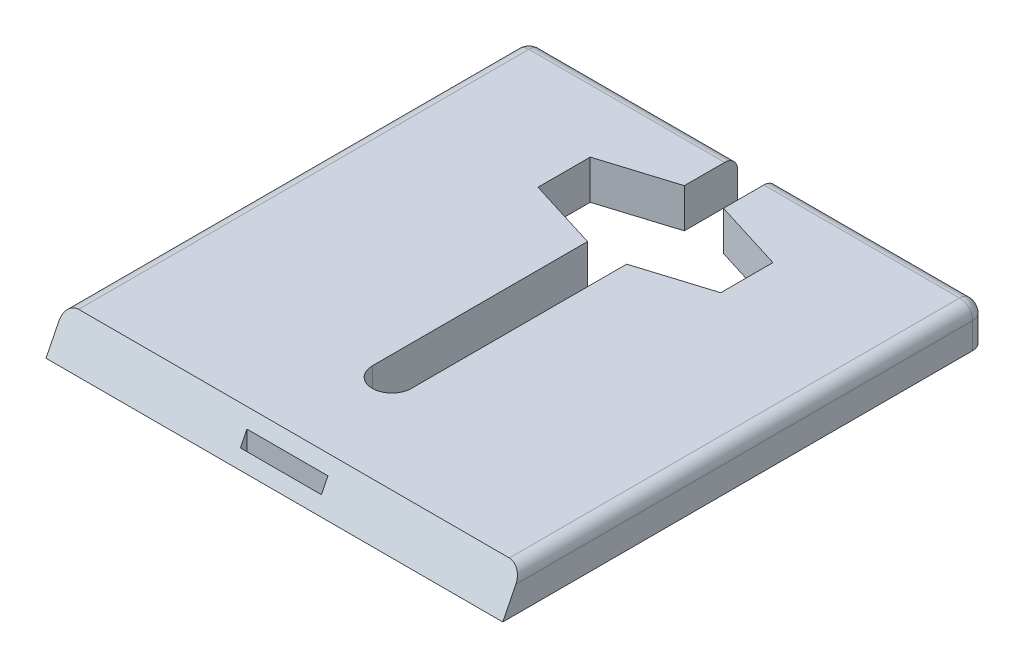
from build123d import *

# Parameters (mm, degrees)
SKIZZE1_W                       = 17.5
SKIZZE1_H                       = 18.5
AUFSATZ_LINEAR_AUSTRAGEN1_DEPTH = 1.5
VERRUNDUNG1_R                   = 0.5
SCHNITT_LINEAR_AUSTRAGEN1_REACH = 21.851
VERRUNDUNG2_R                   = 0.5
SCHL_SSELLOCH_DEPTH             = 1.5
SKIZZE6_W                       = 3.103008178
SKIZZE6_H                       = 0.25
GRIFF_DEPTH                     = 1.5
LANGLOCH_ANTENNE_START          = -1.5
LANGLOCH_ANTENNE_DEPTH          = 1.5
SCHNITT_LINEAR_AUSTRAGEN2_DEPTH = 1.5


with BuildPart() as part:
    # Skizze1 → Aufsatz-Linear austragen1 (new body)
    with BuildSketch(Plane(origin=(0, 0, 0), x_dir=(1, 0, 0), z_dir=(0, 1, 0))):
        Rectangle(SKIZZE1_W, SKIZZE1_H)
    extrude(amount=AUFSATZ_LINEAR_AUSTRAGEN1_DEPTH)

    # Verrundung1
    verrundung1_edges = [part.edges().sort_by_distance(p)[0] for p in [
        (-8.75, 1.5, 0),
        (8.75, 1.5, 0),
        (0, 1.5, -9.25),
    ]]
    fillet(verrundung1_edges, radius=VERRUNDUNG1_R)

    # Schnitt-Linear austragen1: up to this face of the body (flat: up to its plane)
    schnitt_linear_austragen1_end = Plane(part.part.faces().sort_by_distance((8.75, 0.5, 0))[0])
    # Skizze2 → Schnitt-Linear austragen1 (cut, up to the picked face)
    with BuildSketch(Plane.ZY.offset(8.75), mode=Mode.PRIVATE) as schnitt_linear_austragen1_sk1:
        Polygon((9.25, 0), (8.5, 1.5), (9.25, 1.5), align=None)
    schnitt_linear_austragen1_tool1 = split(extrude(schnitt_linear_austragen1_sk1.sketch, amount=-SCHNITT_LINEAR_AUSTRAGEN1_REACH, mode=Mode.PRIVATE), bisect_by=schnitt_linear_austragen1_end, keep=Keep.BOTH, mode=Mode.PRIVATE)
    add(schnitt_linear_austragen1_tool1.solids().sort_by(Axis((-8.75, 1, 9), (1, 0, 0)))[0], mode=Mode.SUBTRACT)

    # Verrundung2
    # the kernel refuses this fillet: 0.5 mm, written as the material it takes off along each edge
    with BuildSketch(Plane(origin=(-8.25, 1, -8.75), x_dir=(-1, 0, 0), z_dir=(0, 0, -1))) as verrundung2_piece_1_section:
        Polygon((0, 0), (VERRUNDUNG2_R, 0), (VERRUNDUNG2_R, VERRUNDUNG2_R), (0, VERRUNDUNG2_R), align=None)
    verrundung2_piece_1 = extrude(amount=VERRUNDUNG2_R, mode=Mode.PRIVATE)
    verrundung2_piece_1 = verrundung2_piece_1 - Plane(origin=(-8.25, 1, -8.75), x_dir=(0.7071067811865475, -0.7071067811865475, 0), z_dir=(0, 0, -1)) * Sphere(VERRUNDUNG2_R, mode=Mode.PRIVATE)
    add(verrundung2_piece_1, mode=Mode.SUBTRACT)
    with BuildSketch(Plane(origin=(8.25, 1, -8.75), x_dir=(0, 0, -1), z_dir=(1, 0, 0))) as verrundung2_piece_2_section:
        Polygon((0, 0), (VERRUNDUNG2_R, 0), (VERRUNDUNG2_R, VERRUNDUNG2_R), (0, VERRUNDUNG2_R), align=None)
    verrundung2_piece_2 = extrude(amount=VERRUNDUNG2_R, mode=Mode.PRIVATE)
    verrundung2_piece_2 = verrundung2_piece_2 - Plane(origin=(8.25, 1, -8.75), x_dir=(0, -0.7071067811865475, 0.7071067811865475), z_dir=(1, 0, 0)) * Sphere(VERRUNDUNG2_R, mode=Mode.PRIVATE)
    add(verrundung2_piece_2, mode=Mode.SUBTRACT)
    with BuildSketch(Plane(origin=(8.75, -1.25, -9.25), x_dir=(0, 0, 1), z_dir=(0, 1, 0)), Plane(origin=(-8.75, -1.25, -9.25), x_dir=(1, 0, 0), z_dir=(0, 1, 0))) as verrundung2_piece_3:
        with BuildLine():
            CenterArc((VERRUNDUNG2_R, -VERRUNDUNG2_R), VERRUNDUNG2_R, 90, 90)
            Line((0, -VERRUNDUNG2_R), (0, 0))
            Line((0, 0), (VERRUNDUNG2_R, 0))
        make_face()
    extrude(amount=2.25, mode=Mode.SUBTRACT)

    # Skizze5 → Schlüsselloch (cut)
    with BuildSketch(Plane(origin=(0, 1.5, 0), x_dir=(1, 0, 0), z_dir=(0, 1, 0))):
        with BuildLine():
            Line((-3.5, 6.35), (-3.5, 4.35))
            Line((-3.5, 4.35), (-1.732050808, 4.35))
            ThreePointArc((-1.732050808, 4.35), (-2, 5.35), (-1.732050808, 6.35))
            Line((-1.732050808, 6.35), (-3.5, 6.35))
        make_face()
        with BuildLine():
            ThreePointArc((1.732050808, 6.35), (0, 7.35), (-1.732050808, 6.35))
            Line((-1.732050808, 6.35), (1.732050808, 6.35))
        make_face()
        with BuildLine():
            ThreePointArc((-1.732050808, 6.35), (-2, 5.35), (-1.732050808, 4.35))
            Line((-1.732050808, 4.35), (1.732050808, 4.35))
            ThreePointArc((1.732050808, 4.35), (1.931851653, 4.83236191), (2, 5.35))
            ThreePointArc((2, 5.35), (1.931851653, 5.86763809), (1.732050808, 6.35))
            Line((1.732050808, 6.35), (-1.732050808, 6.35))
        make_face()
        with BuildLine():
            Line((1.732050808, 4.35), (-1.732050808, 4.35))
            ThreePointArc((-1.732050808, 4.35), (0, 3.35), (1.732050808, 4.35))
        make_face()
        with BuildLine():
            ThreePointArc((2, 5.35), (1.931851653, 4.83236191), (1.732050808, 4.35))
            Line((1.732050808, 4.35), (3.5, 4.35))
            Line((3.5, 4.35), (3.5, 6.35))
            Line((3.5, 6.35), (1.732050808, 6.35))
            ThreePointArc((1.732050808, 6.35), (1.931851653, 5.86763809), (2, 5.35))
        make_face()
    extrude(amount=-SCHL_SSELLOCH_DEPTH, mode=Mode.SUBTRACT)

    # Skizze6 → Griff (cut)
    with BuildSketch(Plane(origin=(0, 1.5, 0), x_dir=(1, 0, 0), z_dir=(0, 1, 0))):
        with Locations((0, -8.875)):
            Rectangle(SKIZZE6_W, SKIZZE6_H)
    extrude(amount=-GRIFF_DEPTH, mode=Mode.SUBTRACT)

    # Skizze7 → Langloch_Antenne (cut)
    with BuildSketch(Plane(origin=(0, 1.5, 0), x_dir=(1, 0, 0), z_dir=(0, 1, 0)).offset(LANGLOCH_ANTENNE_START)):
        with BuildLine():
            Line((0.75, 9.25), (0.75, -4.75))
            ThreePointArc((0.75, -4.75), (0, -5.5), (-0.75, -4.75))
            Line((-0.75, -4.75), (-0.75, 9.25))
            ThreePointArc((-0.75, 9.25), (0, 10), (0.75, 9.25))
        make_face()
    extrude(amount=LANGLOCH_ANTENNE_DEPTH, mode=Mode.SUBTRACT)

    # Skizze8 → Schnitt-Linear austragen2 (cut)
    with BuildSketch(Plane(origin=(0, 1.5, 0), x_dir=(1, 0, 0), z_dir=(0, 1, 0))):
        Polygon((3.5, 4.35), (0.75, 3.495950378), (-0.75, 3.495950378), (-3.5, 4.35), (-3.5, 6.35), (-0.75, 7.204049622), (0.75, 7.204049622), (3.5, 6.35), align=None)
    extrude(amount=-SCHNITT_LINEAR_AUSTRAGEN2_DEPTH, mode=Mode.SUBTRACT)


solid = part.part
